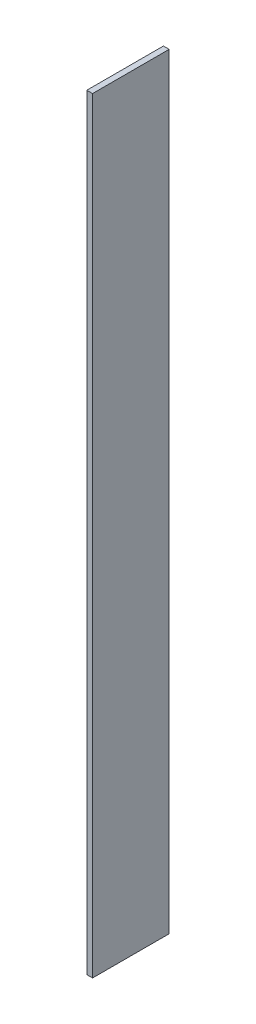
from build123d import *

# Parameters (mm, degrees)
SKETCH_2_W             = 1.5
SKETCH_2_H             = 200
SM_BASE_FLANGE_1_DEPTH = 20


# Sheet-metal steps are written as plain solids
with BuildPart() as part:
    # Sketch 2 → 基体-法兰1 (new body)
    with BuildSketch(Plane.XY):
        with Locations((0.75, 100)):
            Rectangle(SKETCH_2_W, SKETCH_2_H)
    extrude(amount=SM_BASE_FLANGE_1_DEPTH)


solid = part.part
